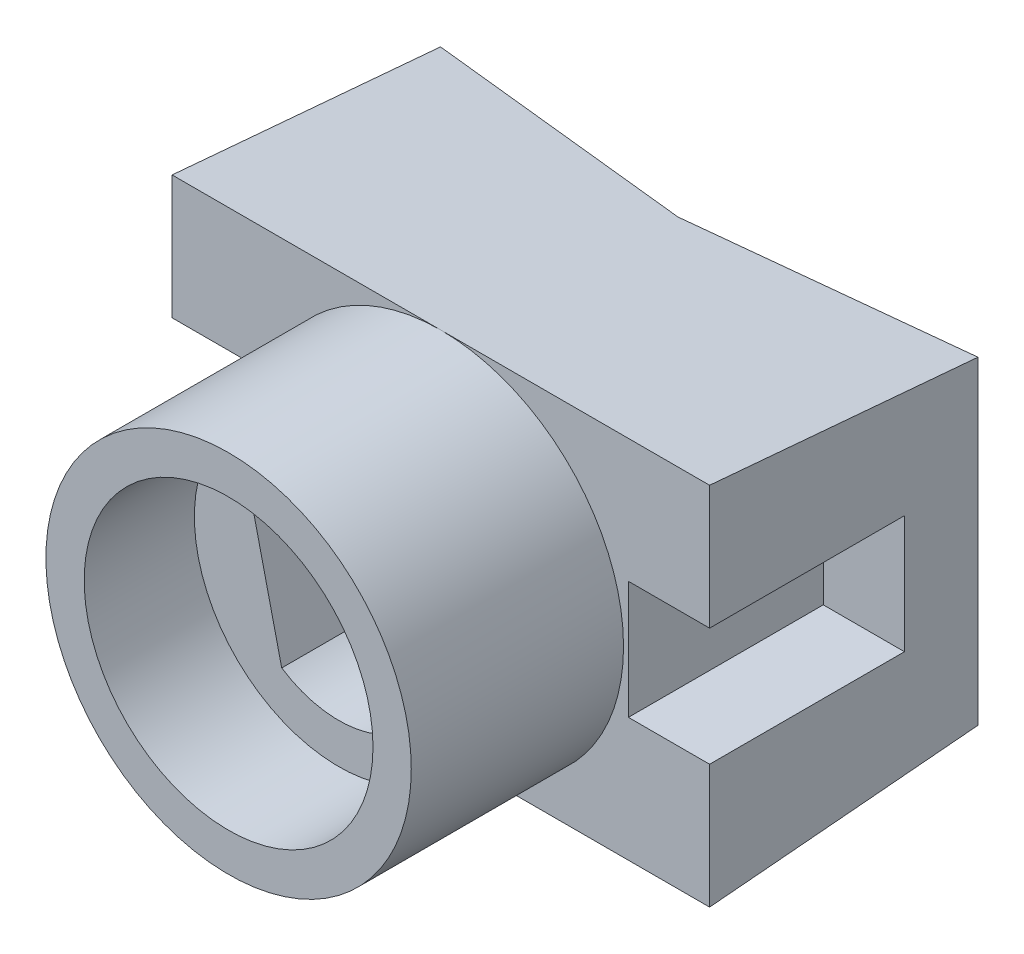
from build123d import *

# Parameters (mm, degrees)
SKETCH1_R           = 7.875
BOSS_EXTRUDE1_DEPTH = 9.15
BOSS_EXTRUDE4_DEPTH = 11.57
SKETCH12_W          = 8.4
SKETCH12_H          = 5.08
CUT_EXTRUDE36_DEPTH = 3.5
SKETCH13_W          = 8.4
SKETCH13_H          = 5.08
CUT_EXTRUDE37_DEPTH = 3.5
SKETCH14_R          = 6.225
CUT_EXTRUDE38_DEPTH = 4.75
CAVITY1_START       = -7.9
CAVITY1_DEPTH       = 12.3
CAVITY1_START_2     = -8.3
CAVITY1_2_DEPTH     = 0.4
CUT_EXTRUDE40_START = -12.7
CUT_EXTRUDE40_DEPTH = 12.7
CUT_EXTRUDE45_DEPTH = 28.068975322
CUT_EXTRUDE46_DEPTH = 10.5


# Read off the part's stored shape, not the designer's step: Cavity1
with BuildPart() as part:
    # Sketch1 → Boss-Extrude1 (new body)
    with BuildSketch(Plane.XY):
        Circle(SKETCH1_R)
    extrude(amount=BOSS_EXTRUDE1_DEPTH)

    # Sketch2 → Boss-Extrude4 (add)
    with BuildSketch(Plane(origin=(0, 0, 0), x_dir=(-1, 0, 0), z_dir=(0, 0, -1))):
        Polygon((-11.585, 7.874861502), (-11.585, -7.874861502), (0, -7.875), (11.585, -7.874861502), (11.585, 7.874861502), (-9.4146e-05, 7.874999999), align=None)
    extrude(amount=BOSS_EXTRUDE4_DEPTH)

    # Sketch12 → Cut-Extrude36 (cut)
    with BuildSketch(Plane.ZY.offset(11.585)):
        with Locations((-4.2, 0)):
            Rectangle(SKETCH12_W, SKETCH12_H)
    extrude(amount=-CUT_EXTRUDE36_DEPTH, mode=Mode.SUBTRACT)

    # Sketch13 → Cut-Extrude37 (cut)
    with BuildSketch(Plane(origin=(11.585, 0, 0), x_dir=(0, 0, -1), z_dir=(1, 0, 0))):
        with Locations((4.2, 0)):
            Rectangle(SKETCH13_W, SKETCH13_H)
    extrude(amount=-CUT_EXTRUDE37_DEPTH, mode=Mode.SUBTRACT)

    # Sketch14 → Cut-Extrude38 (cut)
    with BuildSketch(Plane.XY.offset(9.15)):
        Circle(SKETCH14_R)
    extrude(amount=-CUT_EXTRUDE38_DEPTH, mode=Mode.SUBTRACT)

    # Cavity1 outline → Cavity1 (cut)
    with BuildSketch(Plane.XY.offset(CAVITY1_START)):
        with BuildLine():
            Line((3.870791195, -2.29498922), (2.460102149, 3.768009742))
            ThreePointArc((2.460102149, 3.768009742), (-1.019783438, 4.382926162), (-3.870791195, 2.29498922))
            Line((-3.870791195, 2.29498922), (-2.460102149, -3.768009742))
            ThreePointArc((-2.460102149, -3.768009742), (1.019783438, -4.382926162), (3.870791195, -2.29498922))
        make_face()
        Polygon((0.567084274, 3.078606085), (1.867874704, -2.51205973), (-0.567084274, -3.078606085), (-1.867874704, 2.51205973), align=None, mode=Mode.SUBTRACT)
    extrude(amount=CAVITY1_DEPTH, mode=Mode.SUBTRACT)

    # Cavity1 2 outline → Cavity1 2 (cut)
    with BuildSketch(Plane.XY.offset(CAVITY1_START_2)):
        with BuildLine():
            ThreePointArc((2.195760692, 3.580312135), (-0.951797876, 4.090731084), (-3.550742498, 2.243262738))
            Line((-3.550742498, 2.243262738), (-2.195760692, -3.580312135))
            ThreePointArc((-2.195760692, -3.580312135), (0.951797876, -4.090731084), (3.550742498, -2.243262738))
            Line((3.550742498, -2.243262738), (2.195760692, 3.580312135))
        make_face()
        Polygon((0.567084274, 3.078606085), (1.867874704, -2.51205973), (-0.567084274, -3.078606085), (-1.867874704, 2.51205973), align=None, mode=Mode.SUBTRACT)
    extrude(amount=CAVITY1_2_DEPTH, mode=Mode.SUBTRACT)

    # Sketch15 → Cut-Extrude40 (cut)
    with BuildSketch(Plane.XY.offset(4.4).offset(CUT_EXTRUDE40_START)):
        Polygon((-1.867874704, 2.51205973), (0.567084274, 3.078606085), (1.867874704, -2.51205973), (-0.567084274, -3.078606085), align=None)
    extrude(amount=CUT_EXTRUDE40_DEPTH, mode=Mode.SUBTRACT)

    # Sketch16 → Cut-Extrude45 (cut, through all)
    with BuildSketch(Plane.ZY.offset(11.585)):
        Polygon((0, 7.874861502), (-11.57, 6.8707), (-11.57, 7.874861502), (-11.57, 8.881300341), (0.174713313, 8.881300341), align=None)
        Polygon((0, -7.874861502), (-11.57, -6.8707), (-11.57, -8.73716659), (0, -8.516935753), align=None)
    extrude(amount=-CUT_EXTRUDE45_DEPTH, mode=Mode.SUBTRACT)

    # Sketch17 → Cut-Extrude46 (cut, symmetric)
    with BuildSketch(Plane(origin=(0, 0, 0), x_dir=(1, 0, 0), z_dir=(0, 1, 0))):
        Polygon((-11.585, 11.57), (11.585, 11.57), (0, 10.22), align=None)
    extrude(amount=CUT_EXTRUDE46_DEPTH, both=True, mode=Mode.SUBTRACT)


solid = part.part
